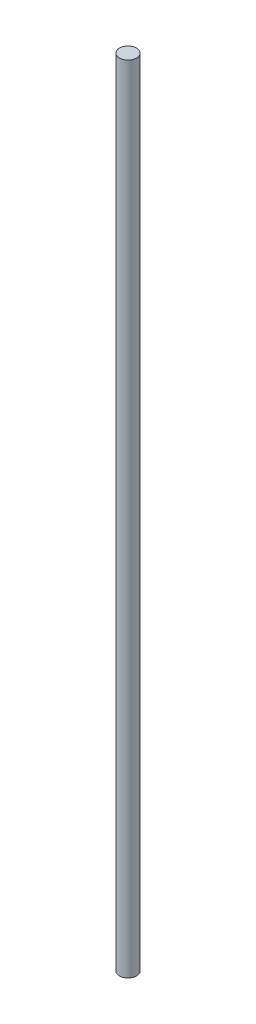
from build123d import *

# Parameters (mm, degrees)
SKETCH1_R           = 4
BOSS_EXTRUDE1_DEPTH = 370


with BuildPart() as part:
    # Sketch1 → Boss-Extrude1 (new body)
    with BuildSketch(Plane(origin=(0, 0, 0), x_dir=(1, 0, 0), z_dir=(0, 1, 0))):
        Circle(SKETCH1_R)
    extrude(amount=BOSS_EXTRUDE1_DEPTH)


solid = part.part
